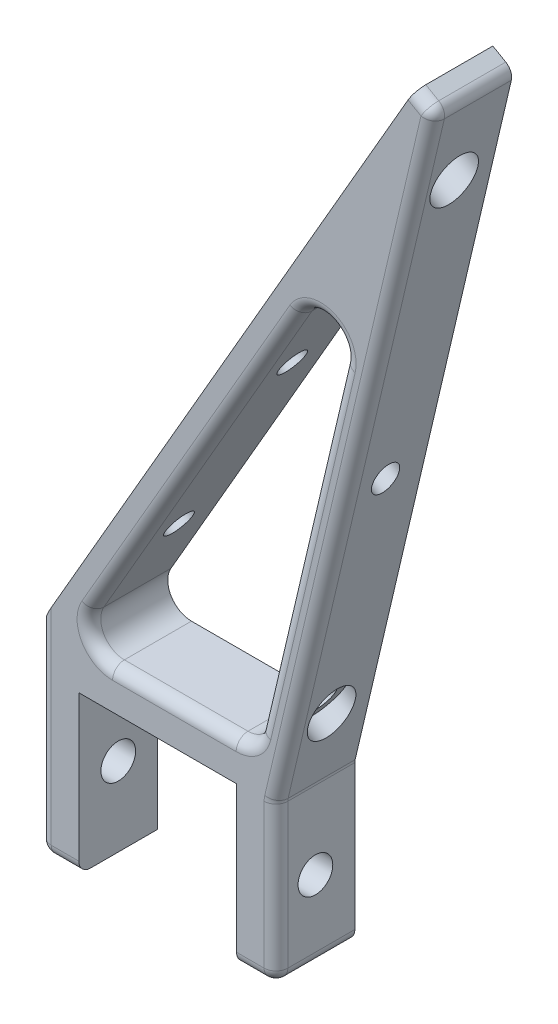
from build123d import *

# Parameters (mm, degrees)
BOSS_EXTRUDE1_DEPTH = 10
CUT_EXTRUDE1_DEPTH  = 95.596978287
FILLET1_R           = 3
FILLET2_R           = 1.5
SKETCH3_R           = 2.2
CUT_EXTRUDE2_DEPTH  = 102.020680113
SKETCH4_R           = 1.75
CUT_EXTRUDE3_DEPTH  = 94.58236857
CUT_EXTRUDE4_START  = 3
SKETCH5_R           = 3
CUT_EXTRUDE4_DEPTH  = 91.712514751
CUT_EXTRUDE5_START  = -24.38
SKETCH6_R           = 3
CUT_EXTRUDE5_DEPTH  = 70.20236857


with BuildPart() as part:
    # Sketch1 → Boss-Extrude1 (new body)
    with BuildSketch(Plane.XY):
        Polygon((-10, -20), (-10, 0), (10, 0), (10, -20), (15, -20), (15, 0), (35.101483834, 85.770445967), (32.5, 87.27241336), (-15, 5), (-15, -20), align=None)
    extrude(amount=BOSS_EXTRUDE1_DEPTH)

    # Sketch2 → Cut-Extrude1 (cut, through all)
    with BuildSketch(Plane.XY.offset(10)):
        Polygon((-10.917498512, 5), (28.214788811, 72.779109859), (12.329822075, 5), align=None)
    extrude(amount=-CUT_EXTRUDE1_DEPTH, mode=Mode.SUBTRACT)

    # Fillet1
    fillet1_edges = [part.edges().sort_by_distance(p)[0] for p in [
        (-10.917498512, 5, 5),
        (12.329822075, 5, 5),
        (28.214788811, 72.779109859, 5),
    ]]
    fillet(fillet1_edges, radius=FILLET1_R)

    # Fillet2
    fillet2_edges = [part.edges().sort_by_distance(p)[0] for p in [
        (35.101483834, 85.770445967, 5),
        (-15, -7.5, 10),
        (33.800741917, 86.521429663, 10),
        (25.050741917, 42.885222984, 10),
        (15, -10, 10),
        (12.5, -20, 10),
        (-12.5, -20, 10),
        (21.765145456, 56.485016027, 10),
        (4.871758353, 32.347795103, 10),
        (-8.3194223, 6.5, 10),
        (2.115139497, 5, 10),
        (11.815273588, 5.649082253, 10),
        (18.227176379, 30.163252268, 10),
        (15, 0, 5),
        (15, -20, 5),
        (-15, -20, 5),
    ]]
    fillet(fillet2_edges, radius=FILLET2_R)

    # Sketch3 → Cut-Extrude2 (cut, through all)
    with BuildSketch(Plane.ZY.offset(15)):
        with Locations((5, -10)):
            Circle(SKETCH3_R)
    extrude(amount=-CUT_EXTRUDE2_DEPTH, mode=Mode.SUBTRACT)

    # Sketch4 → Cut-Extrude3 (cut, through all)
    with BuildSketch(Plane(origin=(-13.415063509, 7.745190528, 0), x_dir=(0, 0, 1), z_dir=(-0.8660254037844382, 0.500000000000001, 0))):
        with Locations((5, 81.330127019)):
            Circle(SKETCH4_R)
        with Locations((5, 44.830127019)):
            Circle(SKETCH4_R)
        with Locations((5, 16.098937019)):
            Circle(SKETCH4_R)
    extrude(amount=-CUT_EXTRUDE3_DEPTH, mode=Mode.SUBTRACT)

    # Sketch5 → Cut-Extrude4 (cut, through all)
    with BuildSketch(Plane(origin=(-13.480526942, 7.631804537, 0), x_dir=(0, 0, -1), z_dir=(0.866025403784438, -0.5000000000000009, 0)).offset(CUT_EXTRUDE4_START)):
        with Locations((-5, 81.461053884)):
            Circle(SKETCH5_R)
    extrude(amount=CUT_EXTRUDE4_DEPTH, mode=Mode.SUBTRACT)

    # Sketch6 → Cut-Extrude5 (cut, through all)
    with BuildSketch(Plane(origin=(-13.415063509, 7.745190528, 0), x_dir=(0, 0, 1), z_dir=(-0.8660254037844382, 0.500000000000001, 0)).offset(CUT_EXTRUDE5_START)):
        with Locations((5, 16.098937019)):
            Circle(SKETCH6_R)
    extrude(amount=-CUT_EXTRUDE5_DEPTH, mode=Mode.SUBTRACT)


solid = part.part
